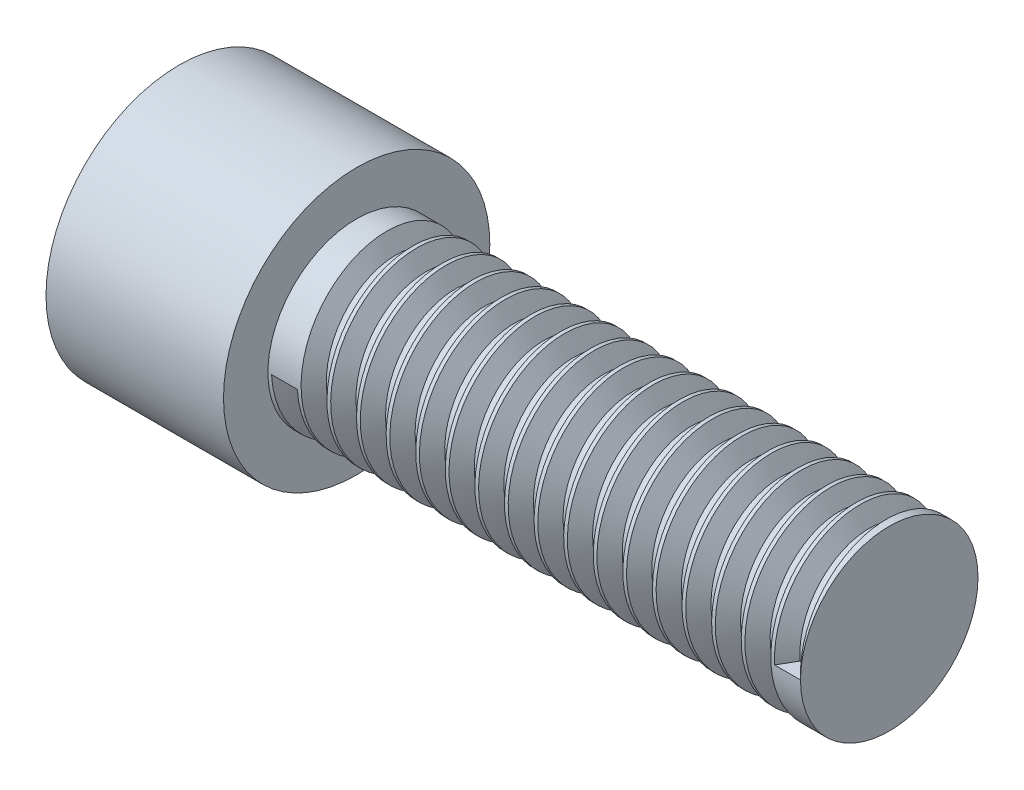
from build123d import *

# Parameters (mm, degrees)
KES_EKSTR_ZYON1_DEPTH = 4
DI_1_PITCH            = 1


with BuildPart() as part:
    # Çizim1 → Döndür1 (revolve)
    with BuildSketch(Plane.XY, mode=Mode.PRIVATE) as d_nd_r1_sk:
        Polygon((0, 0), (0, 3), (-18, 3), (-18, 4.5), (-24, 4.5), (-24, 0), align=None)
    revolve(d_nd_r1_sk.sketch.rotate(Axis((14.485207101, 0, 0), (-1, 0, 0)), 90), axis=Axis((14.485207101, 0, 0), (-1, 0, 0)))

    # Çizim2 → Kes-Ekstrüzyon1 (cut)
    with BuildSketch(Plane.ZY.offset(24)):
        Polygon((3, -1.732050808), (3, 1.732050808), (0, 3.464101615), (-3, 1.732050808), (-3, -1.732050808), (0, -3.464101615), align=None)
    extrude(amount=-KES_EKSTR_ZYON1_DEPTH, mode=Mode.SUBTRACT)

    # Diş1: the profile of Diş Profili1 profile screwed along a right-hand helix of 17 turns, 8 arcs to a turn; built about Z, then put on its axis
    di_1_z = Axis((0, 0, 0), (0, 0, 1))
    di_1_corners = [(3.0003, 0, -0.000173205), (3.0003, 0, 0.875173202), (2.458734125, 0, 0.562499999), (2.458734125, 0, 0.312499999)]
    with BuildLine(mode=Mode.PRIVATE) as di_1_profile:
        Line(di_1_corners[0], di_1_corners[1])
        Line(di_1_corners[1], di_1_corners[2])
        Line(di_1_corners[2], di_1_corners[3])
        Line(di_1_corners[3], di_1_corners[0])
    di_1_cap = Face(di_1_profile.wire())
    di_1_turn_angles = [0, 22.5, 45, 67.5, 90, 112.5, 135, 157.5, 180, 202.5, 225, 247.5, 270, 292.5, 315, 337.5, 360]
    di_1_turn_weights = [1, 0.9238795325112867, 1, 0.9238795325112867, 1, 0.9238795325112867, 1, 0.9238795325112867, 1, 0.9238795325112867, 1, 0.9238795325112867, 1, 0.9238795325112867, 1, 0.9238795325112867, 1]
    di_1_turn_rails = [Edge.make_bspline([Vector(p[0], p[1], 0).rotate(di_1_z, di_1_turn_angles[k]) / di_1_turn_weights[k] + Vector(0, 0, p[2] + DI_1_PITCH * di_1_turn_angles[k] / 360) for k in range(17)], [0, 0, 0, 1, 1, 2, 2, 3, 3, 4, 4, 5, 5, 6, 6, 7, 7, 8, 8, 8], 2, di_1_turn_weights) for p in di_1_corners]
    di_1_turn_sides = [Face.make_surface_from_curves(di_1_turn_rails[p[0]], di_1_turn_rails[p[1]]) for p in [(0, 1), (1, 2), (2, 3), (3, 0)]]
    di_1 = Plane(origin=(0, 0, 0), x_dir=(0, 0, 1), z_dir=(-1, 0, 0)) * Solid(Shell([*[p.moved(Location((0, 0, DI_1_PITCH * i))) for i in range(17) for p in di_1_turn_sides], di_1_cap, di_1_cap.rotate(di_1_z, 6120).moved(Location((0, 0, DI_1_PITCH * 6120 / 360)))]))
    add(di_1, mode=Mode.SUBTRACT)


solid = part.part
